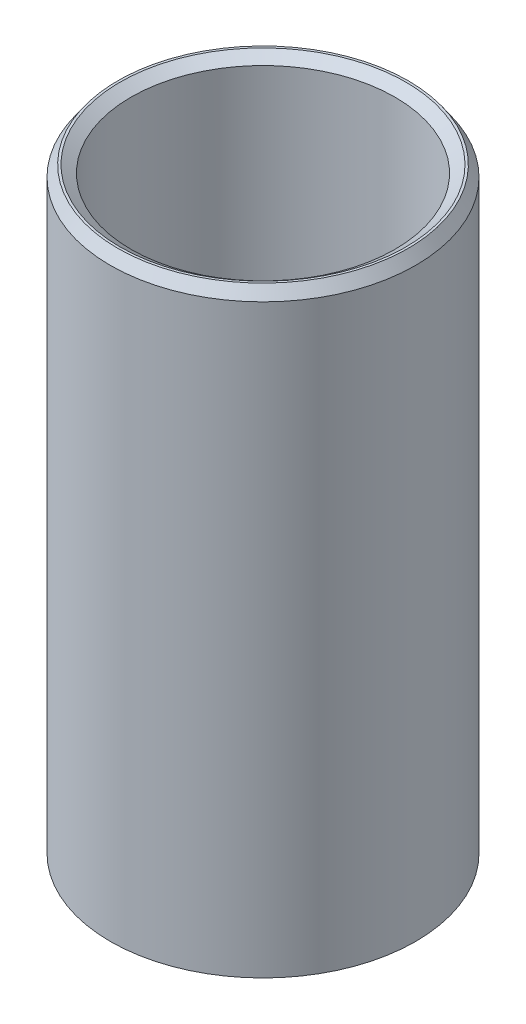
from build123d import *
from OCP.BRepFilletAPI import BRepFilletAPI_MakeChamfer

# Parameters (mm, degrees)
SKETCH1_R           = 55
BOSS_EXTRUDE1_DEPTH = 217.490063754
SKETCH2_R           = 47.505480677
CUT_EXTRUDE1_DEPTH  = 231.980362437
CHAMFER1_SIZE       = 3.938895535
CHAMFER1_SIZE2      = 2.709156946


with BuildPart() as part:
    # Sketch1 → Boss-Extrude1 (new body)
    with BuildSketch(Plane(origin=(0, 0, 0), x_dir=(1, 0, 0), z_dir=(0, 1, 0))):
        Circle(SKETCH1_R)
    extrude(amount=BOSS_EXTRUDE1_DEPTH)

    # Sketch2 → Cut-Extrude1 (cut, through all)
    with BuildSketch(Plane(origin=(0, 0, 0), x_dir=(1, 0, 0), z_dir=(0, 1, 0))):
        Circle(SKETCH2_R)
    extrude(amount=CUT_EXTRUDE1_DEPTH, mode=Mode.SUBTRACT)

    # Chamfer1: one chamfer whose edges measure the first distance from different faces: ONE call of the kernel's chamfer builder (chamfer() names one face for all edges)
    chamfer1_edges_1 = [part.edges().sort_by_distance(p)[0] for p in [
        (-47.505480677, 217.490063754, 0),
    ]]
    chamfer1_side_1 = [part.faces().sort_by_distance(p)[0] for p in [
        (-53.444365081, 217.490063754, 0),
    ]]
    chamfer1_edges_2 = [part.edges().sort_by_distance(p)[0] for p in [
        (-47.505480677, 0, 0),
    ]]
    chamfer1_side_2 = [part.faces().sort_by_distance(p)[0] for p in [
        (-47.505480677, 108.745031877, 0),
    ]]
    chamfer1_edges_3 = [part.edges().sort_by_distance(p)[0] for p in [
        (-55, 0, 0),
    ]]
    chamfer1_side_3 = [part.faces().sort_by_distance(p)[0] for p in [
        (-53.444365081, 0, 0),
    ]]
    chamfer1_edges_4 = [part.edges().sort_by_distance(p)[0] for p in [
        (-55, 217.490063754, 0),
    ]]
    chamfer1_side_4 = [part.faces().sort_by_distance(p)[0] for p in [
        (-55, 108.745031877, 0),
    ]]
    chamfer1 = BRepFilletAPI_MakeChamfer(part.part.solid().wrapped)
    for e in chamfer1_edges_1:
        chamfer1.Add(CHAMFER1_SIZE, CHAMFER1_SIZE2, e.wrapped, chamfer1_side_1[0].wrapped)  # the first distance lies on this face
    for e in chamfer1_edges_2:
        chamfer1.Add(CHAMFER1_SIZE, CHAMFER1_SIZE2, e.wrapped, chamfer1_side_2[0].wrapped)  # the first distance lies on this face
    for e in chamfer1_edges_3:
        chamfer1.Add(CHAMFER1_SIZE, CHAMFER1_SIZE2, e.wrapped, chamfer1_side_3[0].wrapped)  # the first distance lies on this face
    for e in chamfer1_edges_4:
        chamfer1.Add(CHAMFER1_SIZE, CHAMFER1_SIZE2, e.wrapped, chamfer1_side_4[0].wrapped)  # the first distance lies on this face
    add(Compound.cast(chamfer1.Shape()), mode=Mode.REPLACE)


solid = part.part
